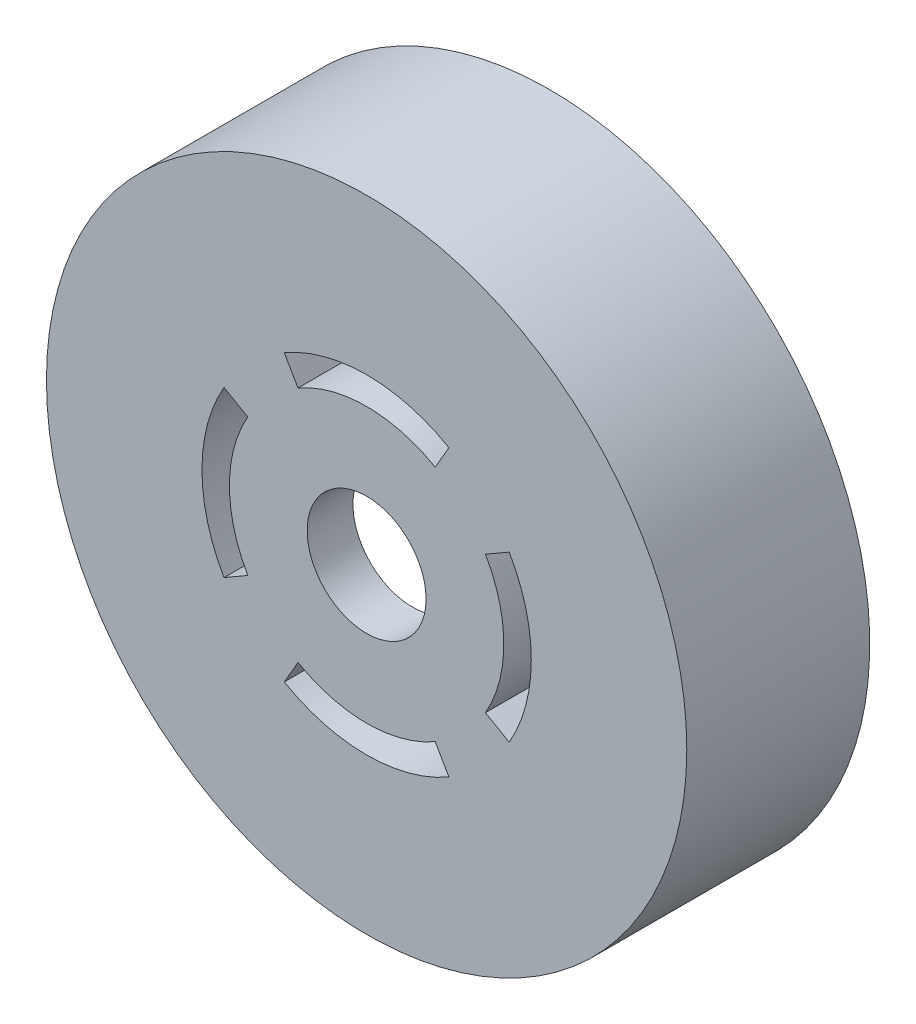
from build123d import *

# Parameters (mm, degrees)
SKETCH_2_R          = 35
SKETCH_2_R_2        = 6.5
EXTRUDE_1_DEPTH     = 5
EXTRUDE_START       = 15
SKETCH_3_R          = 35
SKETCH_3_R_2        = 30.05
EXTRUDE_2_DEPTH     = 15
SKETCH_4_R          = 1.55
CUT_EXTRUDE_1_DEPTH = 10
FILLET_1_R          = 1
CUT_EXTRUDE_2_DEPTH = 52.720402193


with BuildPart() as part:
    # 草图2 → 凸台-拉伸1 (new body)
    with BuildSketch(Plane.XY):
        Circle(SKETCH_2_R)
        Circle(SKETCH_2_R_2, mode=Mode.SUBTRACT)
    extrude(amount=EXTRUDE_1_DEPTH)

    # 草图3 → 凸台-拉伸2 (add)
    with BuildSketch(Plane(origin=(0, 0, 0), x_dir=(-1, 0, 0), z_dir=(0, 0, -1)).offset(EXTRUDE_START)):
        Circle(SKETCH_3_R)
        Circle(SKETCH_3_R_2, mode=Mode.SUBTRACT)
    extrude(amount=-EXTRUDE_2_DEPTH)

    # 草图4 → 切除-拉伸1 (cut)
    with BuildSketch(Plane(origin=(0, 0, -15), x_dir=(-1, 0, 0), z_dir=(0, 0, -1))):
        with Locations((0, 32.5)):
            Circle(SKETCH_4_R)
        with Locations((32.5, 0)):
            Circle(SKETCH_4_R)
        with Locations((0, -32.5)):
            Circle(SKETCH_4_R)
        with Locations((-32.5, 0)):
            Circle(SKETCH_4_R)
    extrude(amount=-CUT_EXTRUDE_1_DEPTH, mode=Mode.SUBTRACT)

    # 圆角1
    # the kernel refuses this fillet: 1 mm, written as the material it takes off along each edge
    with BuildSketch(Plane(origin=(0, 0, -15), x_dir=(-1, 0, 0), z_dir=(0, -1, 0))) as fillet_1_piece_1:
        with BuildLine():
            CenterArc((30.05 + FILLET_1_R, -FILLET_1_R), FILLET_1_R, 90, 90)
            Line((30.05, -FILLET_1_R), (30.05, 0))
            Line((30.05, 0), (30.05 + FILLET_1_R, 0))
        make_face()
    revolve(axis=Axis((0, 0, -15), (0, 0, -1)), mode=Mode.SUBTRACT)

    # 草图5 → 切除-拉伸2 (cut, through all)
    with BuildSketch(Plane(origin=(0, 0, 0), x_dir=(-1, 0, 0), z_dir=(0, 0, -1))):
        with BuildLine():
            Line((12.990381057, -7.5), (15.588457268, -9))
            ThreePointArc((15.588457268, -9), (18, 0), (15.588457268, 9))
            Line((15.588457268, 9), (12.990381057, 7.5))
            ThreePointArc((12.990381057, 7.5), (15, 0), (12.990381057, -7.5))
        make_face()
        with BuildLine():
            Line((-7.5, 12.990381057), (-9, 15.588457268))
            ThreePointArc((-9, 15.588457268), (0, 18), (9, 15.588457268))
            Line((9, 15.588457268), (7.5, 12.990381057))
            ThreePointArc((7.5, 12.990381057), (0, 15), (-7.5, 12.990381057))
        make_face()
        with BuildLine():
            Line((-7.5, -12.990381057), (-9, -15.588457268))
            ThreePointArc((-9, -15.588457268), (0, -18), (9, -15.588457268))
            Line((9, -15.588457268), (7.5, -12.990381057))
            ThreePointArc((7.5, -12.990381057), (0, -15), (-7.5, -12.990381057))
        make_face()
        with BuildLine():
            Line((-12.990381057, 7.5), (-15.588457268, 9))
            ThreePointArc((-15.588457268, 9), (-18, 0), (-15.588457268, -9))
            Line((-15.588457268, -9), (-12.990381057, -7.5))
            ThreePointArc((-12.990381057, -7.5), (-15, 0), (-12.990381057, 7.5))
        make_face()
    extrude(amount=-CUT_EXTRUDE_2_DEPTH, mode=Mode.SUBTRACT)


solid = part.part
